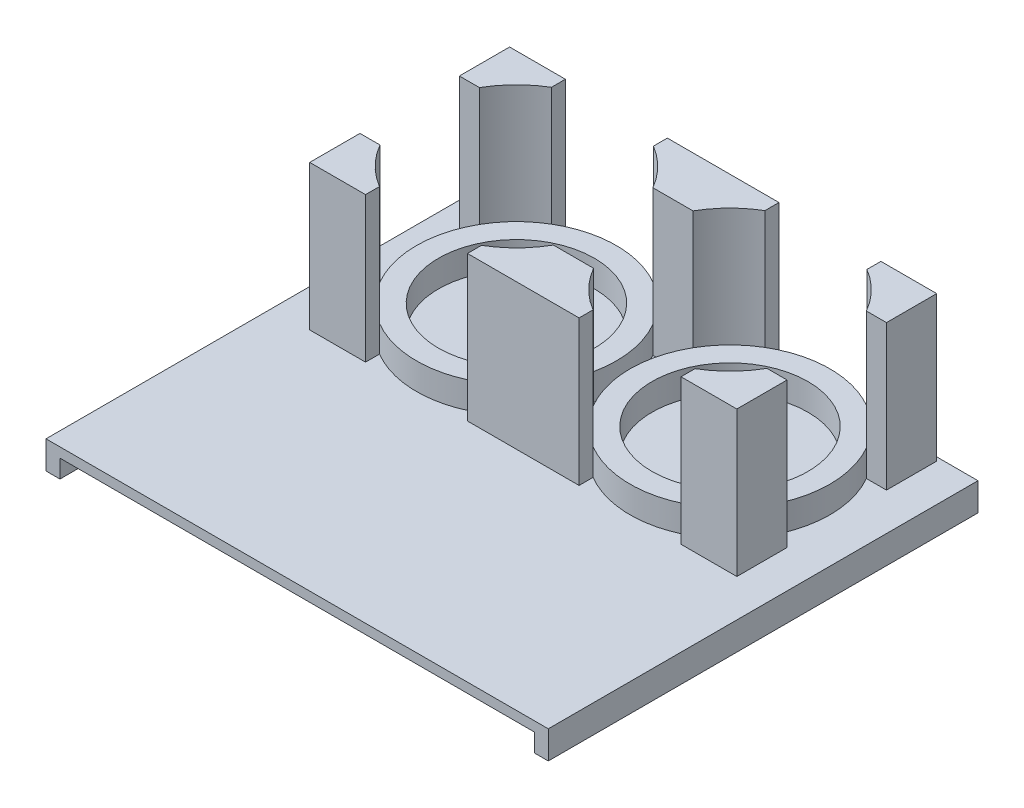
from build123d import *

# Parameters (mm, degrees)
SKETCH1_W           = 85
SKETCH1_H           = 77
BOSS_EXTRUDE1_DEPTH = 1.75
SKETCH3_R           = 17.907
SKETCH3_R_2         = 13.97
BOSS_EXTRUDE3_DEPTH = 4.7625
BOSS_EXTRUDE7_DEPTH = 26
SKETCH6_W           = 77
SKETCH6_H           = 5
BOSS_EXTRUDE8_DEPTH = 2.5


with BuildPart() as part:
    # Sketch1 → Boss-Extrude1 (new body)
    with BuildSketch(Plane(origin=(0, 0, 0), x_dir=(1, 0, 0), z_dir=(0, 1, 0))):
        Rectangle(SKETCH1_W, SKETCH1_H)
    extrude(amount=BOSS_EXTRUDE1_DEPTH)

    # Sketch3 → Boss-Extrude3 (add)
    # profile 1 of 2: a face of its own
    with BuildSketch(Plane(origin=(0, 1.75, 0), x_dir=(1, 0, 0), z_dir=(0, 1, 0))):
        with Locations((-19.133331774, 19.92813227)):
            Circle(SKETCH3_R)
        with Locations((-19.133331774, 19.92813227)):
            Circle(SKETCH3_R_2, mode=Mode.SUBTRACT)
    # profile 2 of 2: a face of its own
    with BuildSketch(Plane(origin=(0, 1.75, 0), x_dir=(1, 0, 0), z_dir=(0, 1, 0))):
        with Locations((19.133331774, 19.92813227)):
            Circle(SKETCH3_R)
        with Locations((19.133331774, 19.92813227)):
            Circle(SKETCH3_R_2, mode=Mode.SUBTRACT)
    extrude(amount=BOSS_EXTRUDE3_DEPTH)

    # Sketch4 → Boss-Extrude7 (add)
    with BuildSketch(Plane(origin=(0, 1.75, 0), x_dir=(1, 0, 0), z_dir=(0, 1, 0))):
        with BuildLine():
            Line((-3.598660873, 28.83513227), (3.598660873, 28.83513227))
            ThreePointArc((3.598660873, 28.83513227), (6.378878026, 32.497323119), (10, 35.330823584))
            Line((10, 35.330823584), (10, 37.83513227))
            Line((10, 37.83513227), (-10, 37.83513227))
            Line((-10, 37.83513227), (-10, 35.330823584))
            ThreePointArc((-10, 35.330823584), (-6.378878026, 32.497323119), (-3.598660873, 28.83513227))
        make_face()
        with BuildLine():
            ThreePointArc((-34.668002675, 28.83513227), (-31.887785522, 32.497323119), (-28.266663548, 35.330823584))
            Line((-28.266663548, 35.330823584), (-28.266663548, 37.83513227))
            Line((-28.266663548, 37.83513227), (-38.266663548, 37.83513227))
            Line((-38.266663548, 37.83513227), (-38.266663548, 28.83513227))
            Line((-38.266663548, 28.83513227), (-34.668002675, 28.83513227))
        make_face()
        with BuildLine():
            Line((28.266663548, 37.83513227), (28.266663548, 35.330823584))
            ThreePointArc((28.266663548, 35.330823584), (31.887785522, 32.497323119), (34.668002675, 28.83513227))
            Line((34.668002675, 28.83513227), (38.266663548, 28.83513227))
            Line((38.266663548, 28.83513227), (38.266663548, 37.83513227))
            Line((38.266663548, 37.83513227), (28.266663548, 37.83513227))
        make_face()
        with BuildLine():
            ThreePointArc((10, 4.525440956), (6.378878026, 7.358941421), (3.598660873, 11.02113227))
            Line((3.598660873, 11.02113227), (-3.598660873, 11.02113227))
            ThreePointArc((-3.598660873, 11.02113227), (-6.378878026, 7.358941421), (-10, 4.525440956))
            Line((-10, 4.525440956), (-10, 2.02113227))
            Line((-10, 2.02113227), (10, 2.02113227))
            Line((10, 2.02113227), (10, 4.525440956))
        make_face()
        with BuildLine():
            ThreePointArc((-28.266663548, 4.525440956), (-31.887785522, 7.358941421), (-34.668002675, 11.02113227))
            Line((-34.668002675, 11.02113227), (-38.266663548, 11.02113227))
            Line((-38.266663548, 11.02113227), (-38.266663548, 2.02113227))
            Line((-38.266663548, 2.02113227), (-28.266663548, 2.02113227))
            Line((-28.266663548, 2.02113227), (-28.266663548, 4.525440956))
        make_face()
        with BuildLine():
            ThreePointArc((34.668002675, 11.02113227), (31.887785522, 7.358941421), (28.266663548, 4.525440956))
            Line((28.266663548, 4.525440956), (28.266663548, 2.02113227))
            Line((28.266663548, 2.02113227), (38.266663548, 2.02113227))
            Line((38.266663548, 2.02113227), (38.266663548, 11.02113227))
            Line((38.266663548, 11.02113227), (34.668002675, 11.02113227))
        make_face()
    extrude(amount=BOSS_EXTRUDE7_DEPTH)

    # Sketch6 → Boss-Extrude8 (add)
    with BuildSketch(Plane.ZY.offset(42.5)):
        with Locations((0, -0.75)):
            Rectangle(SKETCH6_W, SKETCH6_H)
    boss_extrude8 = extrude(amount=BOSS_EXTRUDE8_DEPTH)

    # Mirror1: Boss-Extrude8 across plane
    add(boss_extrude8.mirror(Plane(origin=(0, 0, 0), x_dir=(0, 0, 1), z_dir=(1, 0, 0))))


solid = part.part
